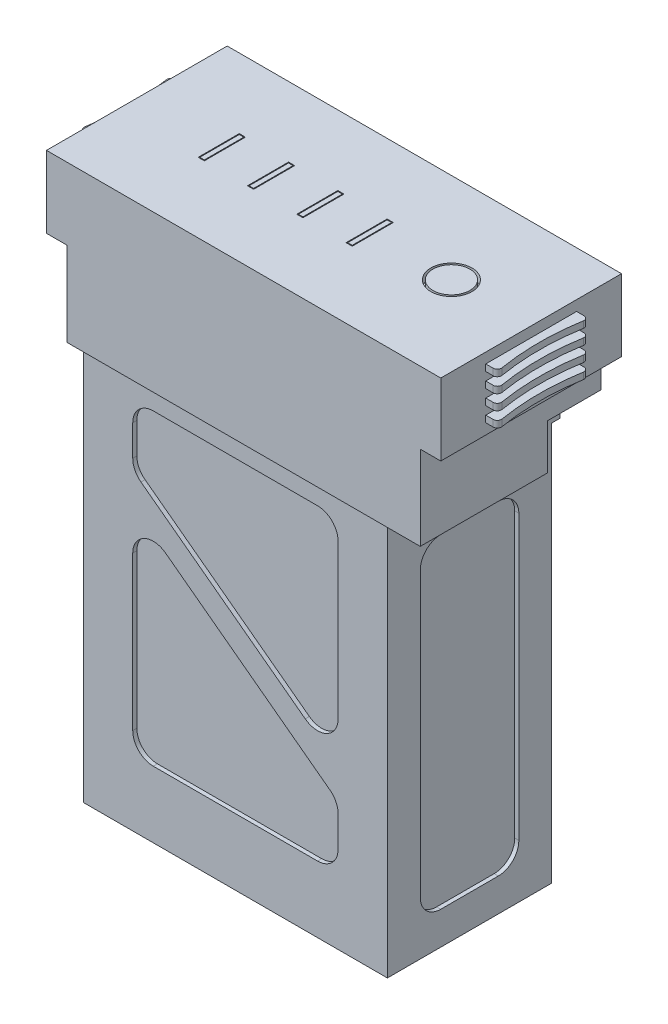
from build123d import *

# Parameters (mm, degrees)
SKETCH_1_W             = 74
SKETCH_1_H             = 40
EXTRUDE_1_DEPTH        = 97
SKETCH_2_W             = 96
SKETCH_2_H             = 44
EXTRUDE_2_DEPTH        = 38
SKETCH_3_W             = 10
SKETCH_3_H             = 13
CUT_EXTRUDE_1_DEPTH    = 11
SKETCH_4_W             = 5
SKETCH_4_H             = 44
CUT_EXTRUDE_2_DEPTH    = 11
SKETCH_5_R             = 5
SKETCH_5_W             = 1.5
SKETCH_5_H             = 10
CUT_EXTRUDE_3_DEPTH    = 2
SKETCH_6_R             = 4.5
SKETCH_6_W             = 1.1
SKETCH_6_H             = 9.6
EXTRUDE_3_DEPTH        = 2
EXTRUDE_4_DEPTH        = 1.6
PATTERN_LINEAR_1_COUNT = 4
PATTERN_LINEAR_1_PITCH = 3.6
MIRROR_2_COPY_1_DEPTH  = 1.6
MIRROR_2_COPY_2_DEPTH  = 1.6
MIRROR_2_COPY_3_DEPTH  = 1.6
CUT_EXTRUDE_4_DEPTH    = 1
CUT_EXTRUDE_5_DEPTH    = 1
SKETCH_10_W            = 5
SKETCH_10_H            = 20.5
SKETCH_10_H_2          = 9.5
CUT_EXTRUDE_6_DEPTH    = 153.199942279


with BuildPart() as part:
    # 草图1 → 凸台-拉伸1 (new body)
    with BuildSketch(Plane(origin=(0, 0, 0), x_dir=(1, 0, 0), z_dir=(0, 1, 0))):
        Rectangle(SKETCH_1_W, SKETCH_1_H)
    extrude(amount=EXTRUDE_1_DEPTH)

    # 草图2 → 凸台-拉伸2 (add)
    with BuildSketch(Plane(origin=(0, 97, 0), x_dir=(1, 0, 0), z_dir=(0, 1, 0))):
        with Locations((4, 0)):
            Rectangle(SKETCH_2_W, SKETCH_2_H)
    extrude(amount=EXTRUDE_2_DEPTH)

    # 草图3 → 切除-拉伸1 (cut)
    with BuildSketch(Plane.XZ.offset(-97)):
        with Locations((42, -15.5)):
            Rectangle(SKETCH_3_W, SKETCH_3_H)
    extrude(amount=-CUT_EXTRUDE_1_DEPTH, mode=Mode.SUBTRACT)

    # 草图4 → 切除-拉伸2 (cut)
    with BuildSketch(Plane.XZ.offset(-97)):
        with Locations((49.5, 0)):
            Rectangle(SKETCH_4_W, SKETCH_4_H)
    extrude(amount=-CUT_EXTRUDE_2_DEPTH, mode=Mode.SUBTRACT)

    # 草图5 → 切除-拉伸3 (cut)
    with BuildSketch(Plane(origin=(0, 135, 0), x_dir=(1, 0, 0), z_dir=(0, 1, 0))):
        with Locations((32.584956569, 0)):
            Circle(SKETCH_5_R)
        with Locations((12.683099686, 0)):
            Rectangle(SKETCH_5_W, SKETCH_5_H)
        with Locations((0.683099686, 0)):
            Rectangle(SKETCH_5_W, SKETCH_5_H)
        with Locations((-11.316900314, 0)):
            Rectangle(SKETCH_5_W, SKETCH_5_H)
        with Locations((-23.316900314, 0)):
            Rectangle(SKETCH_5_W, SKETCH_5_H)
    extrude(amount=-CUT_EXTRUDE_3_DEPTH, mode=Mode.SUBTRACT)

    # 草图6 → 凸台-拉伸3 (add)
    with BuildSketch(Plane(origin=(0, 133, 0), x_dir=(1, 0, 0), z_dir=(0, 1, 0))):
        with Locations((32.584956569, 0)):
            Circle(SKETCH_6_R)
        with Locations((-23.316900314, 0)):
            Rectangle(SKETCH_6_W, SKETCH_6_H)
        with Locations((-11.316900314, 0)):
            Rectangle(SKETCH_6_W, SKETCH_6_H)
        with Locations((0.683099686, 0)):
            Rectangle(SKETCH_6_W, SKETCH_6_H)
        with Locations((12.683099686, 0)):
            Rectangle(SKETCH_6_W, SKETCH_6_H)
    extrude(amount=EXTRUDE_3_DEPTH)

    # 草图7 → 凸台-拉伸4 (add)
    with BuildSketch(Plane(origin=(0, 132.5, 0), x_dir=(1, 0, 0), z_dir=(0, 1, 0))):
        with BuildLine():
            Line((-44, -11.057288531), (-45.807138492, -11.057288531))
            ThreePointArc((-45.807138492, -11.057288531), (-46.570313957, -10.703479841), (-46.793453199, -9.892414949))
            ThreePointArc((-46.793453199, -9.892414949), (-45.972335636, 0), (-46.793453199, 9.892414949))
            ThreePointArc((-46.793453199, 9.892414949), (-46.570313957, 10.703479841), (-45.807138492, 11.057288531))
            Line((-45.807138492, 11.057288531), (-44, 11.057288531))
            Line((-44, 11.057288531), (-44, -11.057288531))
        make_face()
    extrude_4 = extrude(amount=-EXTRUDE_4_DEPTH)

    # 阵列(线性)1: 凸台-拉伸4 ×4
    with Locations(*[(0, -i * PATTERN_LINEAR_1_PITCH, 0) for i in range(1, PATTERN_LINEAR_1_COUNT)]):
        add(extrude_4)

    # 镜向2: 凸台-拉伸4 across plane
    add(extrude_4.mirror(Plane.ZY.offset(-4)))

    # 镜向2 copy 1 sketch → 镜向2 copy 1 (add)
    with BuildSketch(Plane(origin=(8, 128.9, 0), x_dir=(-1, 0, 0), z_dir=(0, 1, 0))):
        with BuildLine():
            Line((-44, 11.057288531), (-45.807138492, 11.057288531))
            ThreePointArc((-45.807138492, 11.057288531), (-46.570313957, 10.703479841), (-46.793453199, 9.892414949))
            ThreePointArc((-46.793453199, 9.892414949), (-45.972335636, 0), (-46.793453199, -9.892414949))
            ThreePointArc((-46.793453199, -9.892414949), (-46.570313957, -10.703479841), (-45.807138492, -11.057288531))
            Line((-45.807138492, -11.057288531), (-44, -11.057288531))
            Line((-44, -11.057288531), (-44, 11.057288531))
        make_face()
    extrude(amount=-MIRROR_2_COPY_1_DEPTH)

    # 镜向2 copy 2 sketch → 镜向2 copy 2 (add)
    with BuildSketch(Plane(origin=(8, 125.3, 0), x_dir=(-1, 0, 0), z_dir=(0, 1, 0))):
        with BuildLine():
            Line((-44, 11.057288531), (-45.807138492, 11.057288531))
            ThreePointArc((-45.807138492, 11.057288531), (-46.570313957, 10.703479841), (-46.793453199, 9.892414949))
            ThreePointArc((-46.793453199, 9.892414949), (-45.972335636, 0), (-46.793453199, -9.892414949))
            ThreePointArc((-46.793453199, -9.892414949), (-46.570313957, -10.703479841), (-45.807138492, -11.057288531))
            Line((-45.807138492, -11.057288531), (-44, -11.057288531))
            Line((-44, -11.057288531), (-44, 11.057288531))
        make_face()
    extrude(amount=-MIRROR_2_COPY_2_DEPTH)

    # 镜向2 copy 3 sketch → 镜向2 copy 3 (add)
    with BuildSketch(Plane(origin=(8, 121.7, 0), x_dir=(-1, 0, 0), z_dir=(0, 1, 0))):
        with BuildLine():
            Line((-44, 11.057288531), (-45.807138492, 11.057288531))
            ThreePointArc((-45.807138492, 11.057288531), (-46.570313957, 10.703479841), (-46.793453199, 9.892414949))
            ThreePointArc((-46.793453199, 9.892414949), (-45.972335636, 0), (-46.793453199, -9.892414949))
            ThreePointArc((-46.793453199, -9.892414949), (-46.570313957, -10.703479841), (-45.807138492, -11.057288531))
            Line((-45.807138492, -11.057288531), (-44, -11.057288531))
            Line((-44, -11.057288531), (-44, 11.057288531))
        make_face()
    extrude(amount=-MIRROR_2_COPY_3_DEPTH)

    # 草图8 → 切除-拉伸4 (cut)
    with BuildSketch(Plane.ZY.offset(37)):
        with BuildLine():
            Line((-7, 87), (7, 87))
            ThreePointArc((7, 87), (10.535533906, 85.535533906), (12, 82))
            Line((12, 82), (12, 13))
            ThreePointArc((12, 13), (10.535533906, 9.464466094), (7, 8))
            Line((7, 8), (-7, 8))
            ThreePointArc((-7, 8), (-10.535533906, 9.464466094), (-12, 13))
            Line((-12, 13), (-12, 82))
            ThreePointArc((-12, 82), (-10.535533906, 85.535533906), (-7, 87))
        make_face()
    cut_extrude_4 = extrude(amount=-CUT_EXTRUDE_4_DEPTH, mode=Mode.SUBTRACT)

    # 镜向3: 切除-拉伸4 across plane
    add(cut_extrude_4.mirror(Plane(origin=(0, 0, 0), x_dir=(0, 0, 1), z_dir=(1, 0, 0))), mode=Mode.SUBTRACT)

    # 草图9 → 切除-拉伸5 (cut)
    with BuildSketch(Plane(origin=(0, 0, -20), x_dir=(-1, 0, 0), z_dir=(0, 0, -1))):
        with BuildLine():
            Line((-20, 91.06721858), (20, 91.06721858))
            ThreePointArc((20, 91.06721858), (23.535533906, 89.602752486), (25, 86.06721858))
            Line((25, 86.06721858), (25, 78.57061248))
            ThreePointArc((25, 78.57061248), (24.470921387, 76.332117014), (22.995655219, 74.567357579))
            Line((22.995655219, 74.567357579), (-17.004344781, 44.635161975))
            ThreePointArc((-17.004344781, 44.635161975), (-22.238495466, 44.167495489), (-25, 48.638416876))
            Line((-25, 48.638416876), (-25, 86.06721858))
            ThreePointArc((-25, 86.06721858), (-23.535533906, 89.602752486), (-20, 91.06721858))
        make_face()
        with BuildLine():
            Line((-22.995655219, 32.657933054), (17.004344781, 62.590128658))
            ThreePointArc((17.004344781, 62.590128658), (22.238495466, 63.057795143), (25, 58.586873756))
            Line((25, 58.586873756), (25, 21.158072053))
            ThreePointArc((25, 21.158072053), (23.535533906, 17.622538147), (20, 16.158072053))
            Line((20, 16.158072053), (-20, 16.158072053))
            ThreePointArc((-20, 16.158072053), (-23.535533906, 17.622538147), (-25, 21.158072053))
            Line((-25, 21.158072053), (-25, 28.654678152))
            ThreePointArc((-25, 28.654678152), (-24.470921387, 30.893173618), (-22.995655219, 32.657933054))
        make_face()
    cut_extrude_5 = extrude(amount=-CUT_EXTRUDE_5_DEPTH, mode=Mode.SUBTRACT)

    # 镜向4: 切除-拉伸5 across plane
    add(cut_extrude_5.mirror(Plane.XY), mode=Mode.SUBTRACT)

    # 草图10 → 切除-拉伸6 (cut, through all)
    with BuildSketch(Plane(origin=(0, 0, -22), x_dir=(-1, 0, 0), z_dir=(0, 0, -1))):
        with Locations((41.5, 107.25)):
            Rectangle(SKETCH_10_W, SKETCH_10_H)
        with Locations((-49.5, 112.75)):
            Rectangle(SKETCH_10_W, SKETCH_10_H_2)
    extrude(amount=-CUT_EXTRUDE_6_DEPTH, mode=Mode.SUBTRACT)


solid = part.part
